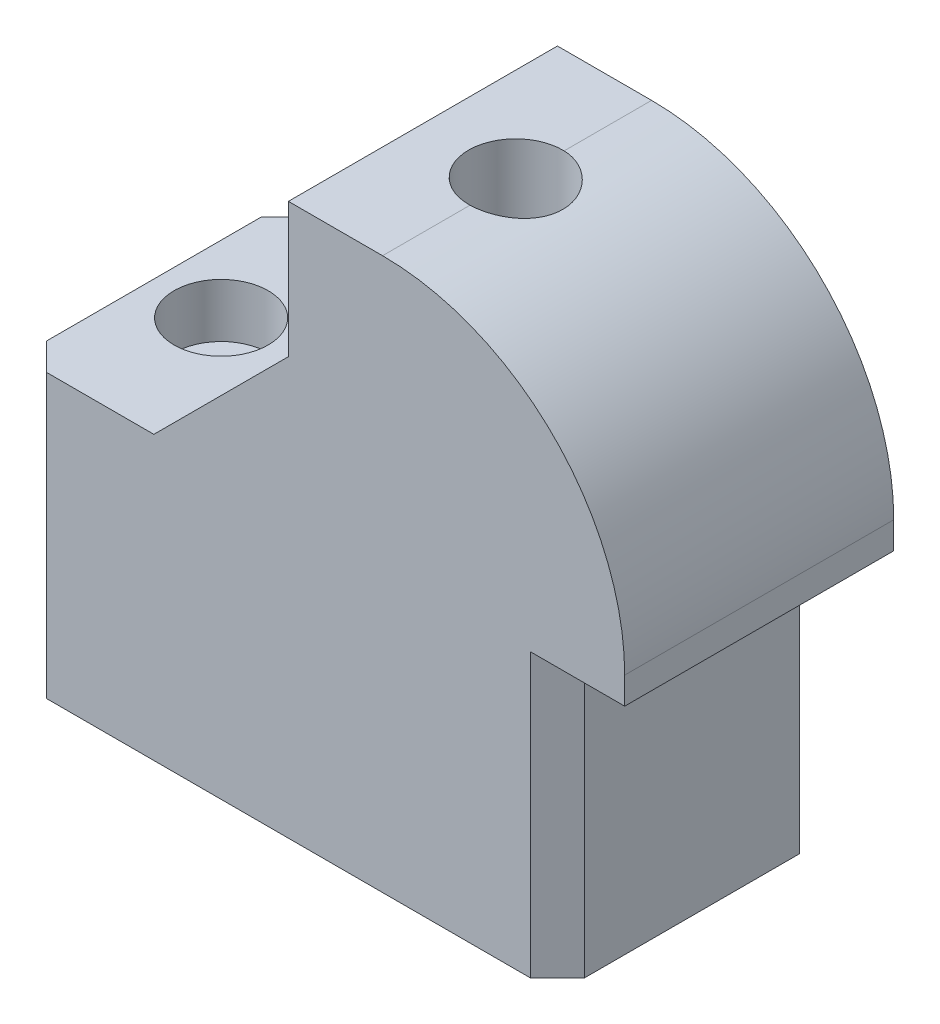
from build123d import *

# Parameters (mm, degrees)
SKETCH1_W               = 50.8
SKETCH1_H               = 25.4
BOSS_EXTRUDE1_DEPTH     = 26.67
SKETCH2_W               = 6.35
SKETCH2_H               = 25.4
BOSS_EXTRUDE2_DEPTH     = 25.4
SKETCH3_W               = 25.4
SKETCH3_H               = 25.4
BOSS_EXTRUDE3_DEPTH     = 25.4
CHAMFER1_SIZE           = 12.7
SKETCH4_R               = 2.413
CUT_EXTRUDE1_DEPTH      = 71.034483649
SKETCH4_4_R             = 4.445
SKETCH4_4_R_2           = 2.413
CUT_EXTRUDE2_DEPTH      = 5.08
CUT_EXTRUDE3_DEPTH      = 29.972
CUT_EXTRUDE3_DEPTH_BACK = 1.27
CUT_EXTRUDE3_START      = -25.4
SKETCH5_R               = 4.445
CHAMFER3_SIZE           = 2.54
FILLET1_R               = 22.86


with BuildPart() as part:
    # Sketch1 → Boss-Extrude1 (new body)
    with BuildSketch(Plane(origin=(0, 0, 0), x_dir=(1, 0, 0), z_dir=(0, 1, 0))):
        with Locations((-38.1, 0)):
            Rectangle(SKETCH1_W, SKETCH1_H)
    extrude(amount=BOSS_EXTRUDE1_DEPTH)



with BuildPart() as body_2:
    # Sketch2 → Boss-Extrude2 (new body)
    with BuildSketch(Plane(origin=(0, 26.67, 0), x_dir=(1, 0, 0), z_dir=(0, 1, 0))):
        with Locations((-9.525, 0)):
            Rectangle(SKETCH2_W, SKETCH2_H)
    extrude(amount=BOSS_EXTRUDE2_DEPTH)


with BuildPart() as part_1:
    add(part.part)

    add(body_2.part)  # Boss-Extrude3 merges body 2
    # Sketch3 → Boss-Extrude3 (add)
    with BuildSketch(Plane(origin=(0, 26.67, 0), x_dir=(1, 0, 0), z_dir=(0, 1, 0))):
        with Locations((-25.4, 0)):
            Rectangle(SKETCH3_W, SKETCH3_H)
    extrude(amount=BOSS_EXTRUDE3_DEPTH)

    # Chamfer1
    chamfer1_edges = [part_1.edges().sort_by_distance(p)[0] for p in [
        (-38.1, 26.67, 0),
    ]]
    chamfer(chamfer1_edges, length=CHAMFER1_SIZE)

    # Sketch4 → Cut-Extrude1 (cut, through all)
    with BuildSketch(Plane(origin=(0, 26.67, 0), x_dir=(1, 0, 0), z_dir=(0, 1, 0))):
        with Locations(Location((-57.15, 0, 0), (0, 0, 270))):
            Circle(SKETCH4_R)
        with Locations(Location((-29.339108581, 0, 0), (0, 0, 270))):
            Circle(SKETCH4_R)
    extrude(amount=-CUT_EXTRUDE1_DEPTH, mode=Mode.SUBTRACT)

    # Sketch4<4> → Cut-Extrude2 (cut)
    # profile 1 of 2: a face of its own
    with BuildSketch(Plane(origin=(0, 26.67, 0), x_dir=(1, 0, 0), z_dir=(0, 1, 0))):
        with Locations(Location((-57.15, 0, 0), (0, 0, 270))):
            Circle(SKETCH4_4_R)
        with Locations(Location((-57.15, 0, 0), (0, 0, 270))):
            Circle(SKETCH4_4_R_2, mode=Mode.SUBTRACT)
    # profile 2 of 2: a face of its own
    with BuildSketch(Plane(origin=(0, 26.67, 0), x_dir=(1, 0, 0), z_dir=(0, 1, 0))):
        with Locations(Location((-29.339108581, 0, 0), (0, 0, 270))):
            Circle(SKETCH4_4_R)
        with Locations(Location((-29.339108581, 0, 0), (0, 0, 270))):
            Circle(SKETCH4_4_R_2, mode=Mode.SUBTRACT)
    extrude(amount=-CUT_EXTRUDE2_DEPTH, mode=Mode.SUBTRACT)

    # Sketch5 → Cut-Extrude3 (cut, two sides: drawn at the far end of the back side and taken through both)
    with BuildSketch(Plane(origin=(0, 52.07, 0), x_dir=(1, 0, 0), z_dir=(0, 1, 0)).offset(CUT_EXTRUDE3_START - CUT_EXTRUDE3_DEPTH_BACK)):
        with Locations(Location((-29.339108581, 0, 0), (0, 0, 270))):
            Circle(SKETCH5_R)
    extrude(amount=CUT_EXTRUDE3_DEPTH + CUT_EXTRUDE3_DEPTH_BACK, mode=Mode.SUBTRACT)

    # Chamfer3
    chamfer3_edges = [part_1.edges().sort_by_distance(p)[0] for p in [
        (-12.7, 13.335, -12.7),
        (-12.7, 13.335, 12.7),
        (-63.5, 13.335, -12.7),
        (-63.5, 13.335, 12.7),
    ]]
    chamfer(chamfer3_edges, length=CHAMFER3_SIZE)

    # Fillet1
    # the kernel refuses this fillet: 22.86 mm, written as the material it takes off along each edge
    with BuildSketch(Plane(origin=(-6.35, 52.07, -69.85), x_dir=(-1, 0, 0), z_dir=(0, 0, 1))) as fillet1_piece_1:
        with BuildLine():
            CenterArc((FILLET1_R, FILLET1_R), FILLET1_R, 180, 90)
            Line((0, FILLET1_R), (0, 0))
            Line((0, 0), (FILLET1_R, 0))
        make_face()
    extrude(amount=139.7, mode=Mode.SUBTRACT)


solid = part_1.part
